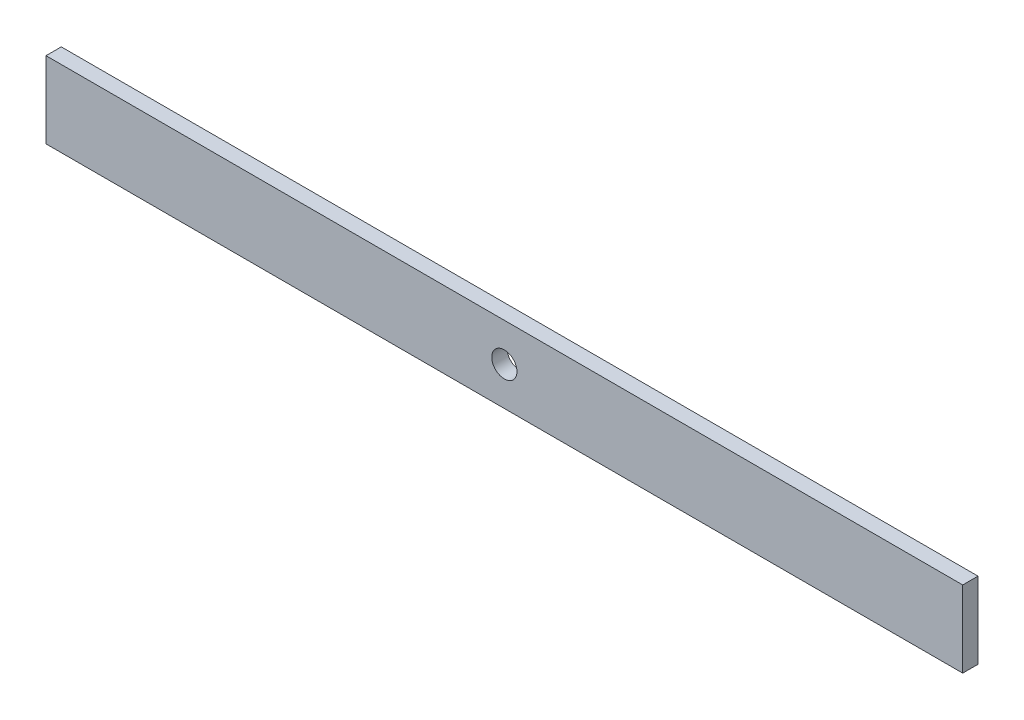
from build123d import *

# Parameters (mm, degrees)
ESBO_O1_W                                      = 120
ESBO_O1_H                                      = 10
FLANGE_BASE1_DEPTH                             = 2
BROCA_DE_ROSQUEAR_DE_CANO_PARA_TARRAXA_D_D     = 3.3
BROCA_DE_ROSQUEAR_DE_CANO_PARA_TARRAXA_D_DEPTH = 4
BROCA_DE_ROSQUEAR_DE_CANO_PARA_TARRAXA_D_TIP   = 0.991420021


# Sheet-metal steps are written as plain solids
with BuildPart() as part:
    # Esboço1 → Flange-base1 (new body)
    with BuildSketch(Plane.XY):
        Rectangle(ESBO_O1_W, ESBO_O1_H)
    extrude(amount=-FLANGE_BASE1_DEPTH)

    # Broca de rosquear de cano para tarraxa de 1/81
    with Locations(Plane(origin=(0, 0, -2), x_dir=(-1, 0, 0), z_dir=(0, 0, -1))):
        with Locations((0, 0)):
            Hole(BROCA_DE_ROSQUEAR_DE_CANO_PARA_TARRAXA_D_D / 2, depth=BROCA_DE_ROSQUEAR_DE_CANO_PARA_TARRAXA_D_DEPTH)
            with Locations((0, 0, -(BROCA_DE_ROSQUEAR_DE_CANO_PARA_TARRAXA_D_DEPTH + BROCA_DE_ROSQUEAR_DE_CANO_PARA_TARRAXA_D_TIP / 2))):  # 118° drill point
                Cone(0, BROCA_DE_ROSQUEAR_DE_CANO_PARA_TARRAXA_D_D / 2, BROCA_DE_ROSQUEAR_DE_CANO_PARA_TARRAXA_D_TIP, mode=Mode.SUBTRACT)


solid = part.part
